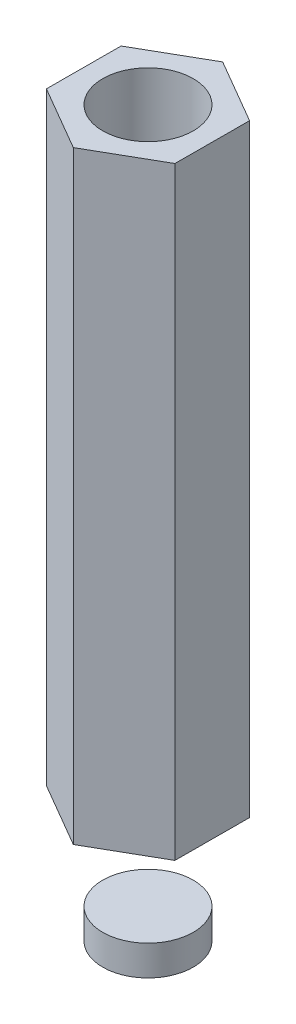
from build123d import *

# Parameters (mm, degrees)
ESQUISSE1_R             = 1.5
BOSS_EXTRU_1_DEPTH      = 4
BOSS_EXTRU_2_DEPTH      = 20
ENL_V_START             = -4
ESQUISSE3_R             = 1.5
ENL_V_MAT_EXTRU_1_DEPTH = 4
PER_AGE1_START          = 1
PER_AGE1_OUTLINE_R      = 1.5
PER_AGE1_DEPTH          = 3


# Read off the part's stored shape, not the designer's step: Perçage1
with BuildPart() as part:
    # Esquisse1 → Boss.-Extru.1 (new body)
    with BuildSketch(Plane(origin=(0, 0, 0), x_dir=(1, 0, 0), z_dir=(0, 1, 0))):
        with Locations(Location((0, 0, 0), (0, 0, 270))):
            Circle(ESQUISSE1_R)
    extrude(amount=BOSS_EXTRU_1_DEPTH)

    # Esquisse2 → Boss.-Extru.2 (add)
    with BuildSketch(Plane(origin=(0, 4, 0), x_dir=(-1, 0, 0), z_dir=(0, 1, 0))):
        Polygon((2.131865991, -1.240236504), (2.140009315, 1.226131853), (0.008143324, 2.466368358), (-2.131865991, 1.240236504), (-2.140009315, -1.226131853), (-0.008143324, -2.466368358), align=None)
    extrude(amount=BOSS_EXTRU_2_DEPTH)

    # Esquisse3 → Enlèv. mat.-Extru.1 (cut)
    with BuildSketch(Plane(origin=(0, 24, 0), x_dir=(-1, 0, 0), z_dir=(0, 1, 0)).offset(ENL_V_START)):
        with Locations(Location((0, 0, 0), (0, 0, 90))):
            Circle(ESQUISSE3_R)
    extrude(amount=ENL_V_MAT_EXTRU_1_DEPTH, mode=Mode.SUBTRACT)

    # Perçage1 outline → Perçage1 (cut)
    with BuildSketch(Plane(origin=(0, 0, 0), x_dir=(1, 0, 0), z_dir=(0, 1, 0)).offset(PER_AGE1_START)):
        Circle(PER_AGE1_OUTLINE_R)
    extrude(amount=PER_AGE1_DEPTH, mode=Mode.SUBTRACT)


solid = part.part
